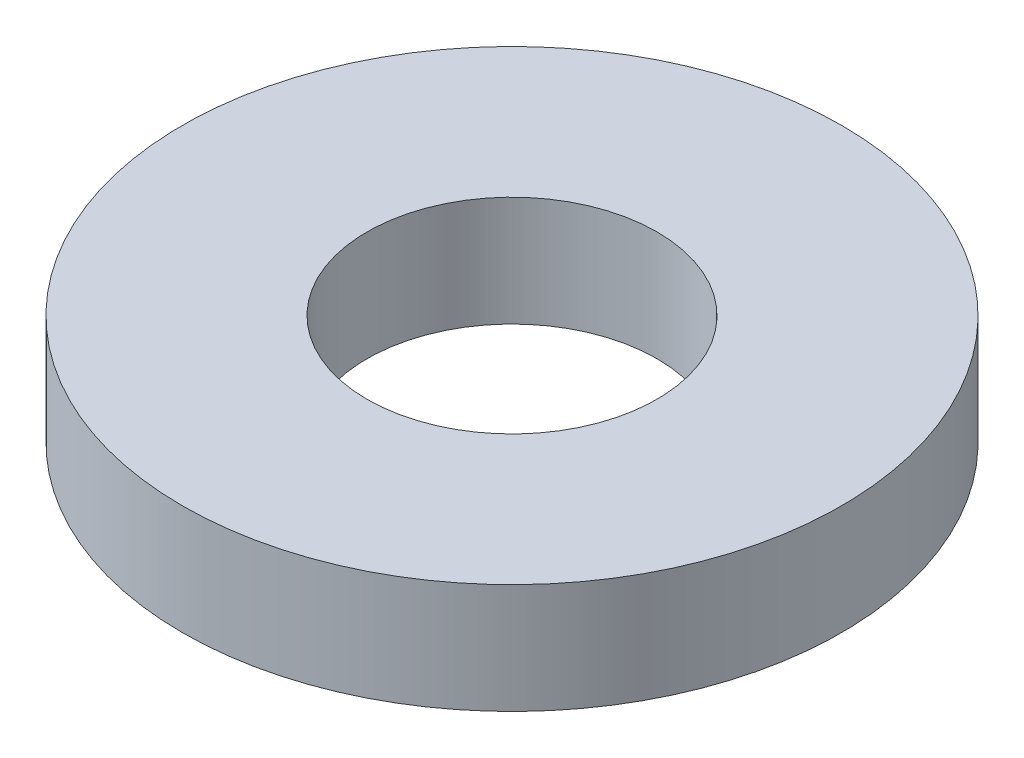
from build123d import *

# Parameters (mm, degrees)
SKETCH1_R           = 4.7625
SKETCH1_R_2         = 2.0955
BOSS_EXTRUDE1_DEPTH = 1.5875


with BuildPart() as part:
    # Sketch1 → Boss-Extrude1 (new body)
    with BuildSketch(Plane(origin=(0, 0, 0), x_dir=(1, 0, 0), z_dir=(0, 1, 0))):
        Circle(SKETCH1_R)
        Circle(SKETCH1_R_2, mode=Mode.SUBTRACT)
    extrude(amount=BOSS_EXTRUDE1_DEPTH)


solid = part.part
